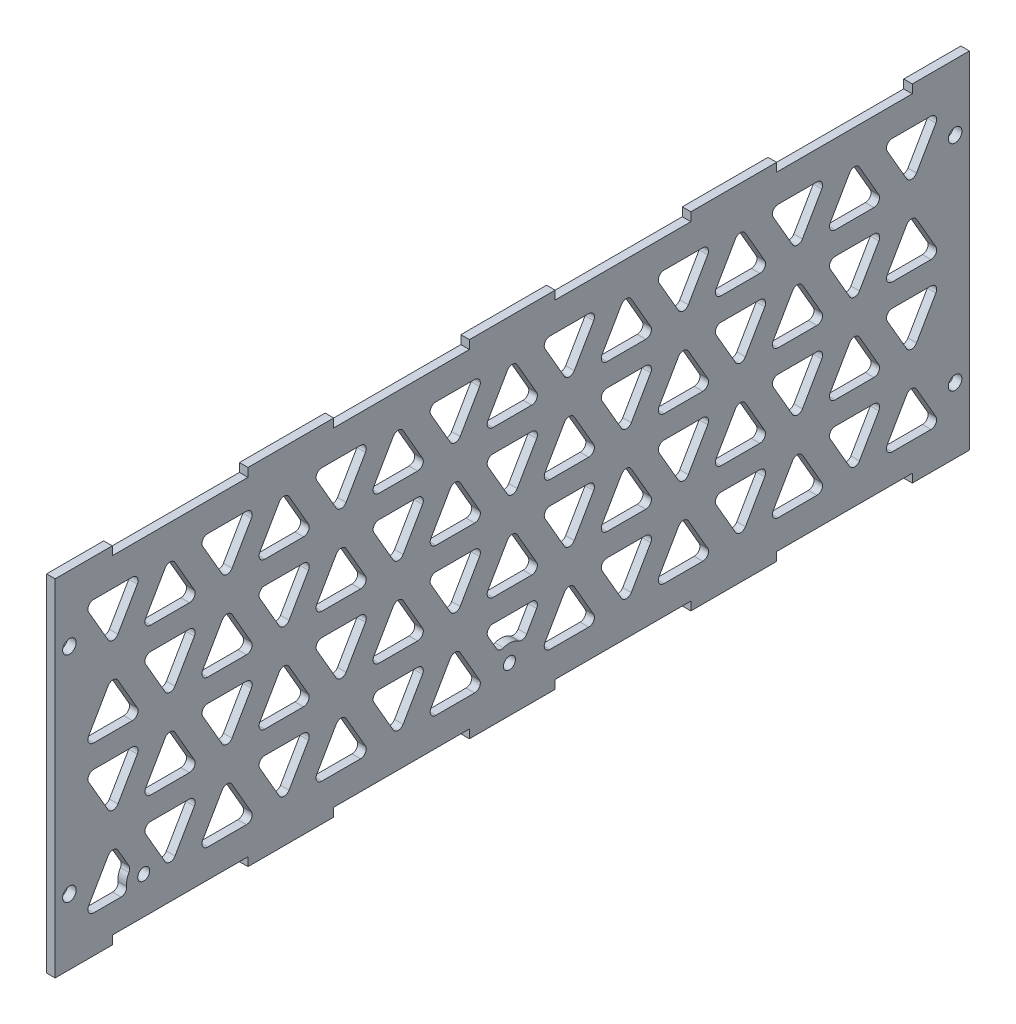
from build123d import *

# Parameters (mm, degrees)
SKETCH1_W           = 320
SKETCH1_H           = 115
BOSS_EXTRUDE1_DEPTH = 1.5
SKETCH2_W           = 20
SKETCH2_H           = 3
SKETCH2_W_2         = 30
BOSS_EXTRUDE2_DEPTH = 3
CUT_EXTRUDE3_REACH  = 173.083
SKETCH4_R           = 2.375
CUT_EXTRUDE4_DEPTH  = 3
SKETCH6_R           = 6
BOSS_EXTRUDE4_DEPTH = 3
SKETCH7_R           = 2.1
CUT_EXTRUDE6_DEPTH  = 172.082582398
FILLET2_R           = 2


with BuildPart() as part:
    # Sketch1 → Boss-Extrude1 (new, symmetric)
    with BuildSketch(Plane(origin=(0, 0, 0), x_dir=(0, 0, -1), z_dir=(1, 0, 0))):
        Rectangle(SKETCH1_W, SKETCH1_H)
    extrude(amount=BOSS_EXTRUDE1_DEPTH, both=True)

    # Sketch2 → Boss-Extrude2 (add)
    with BuildSketch(Plane(origin=(1.5, 0, 0), x_dir=(0, 0, -1), z_dir=(1, 0, 0))):
        with Locations((-150, 59)):
            Rectangle(SKETCH2_W, SKETCH2_H)
        with Locations((-77.5, 59)):
            Rectangle(SKETCH2_W_2, SKETCH2_H)
        with Locations((0, 59)):
            Rectangle(SKETCH2_W_2, SKETCH2_H)
        with Locations((77.5, 59)):
            Rectangle(SKETCH2_W_2, SKETCH2_H)
        with Locations((150, 59)):
            Rectangle(SKETCH2_W, SKETCH2_H)
    boss_extrude2 = extrude(amount=-BOSS_EXTRUDE2_DEPTH)

    # Mirror1: Boss-Extrude2 across plane
    add(boss_extrude2.mirror(Plane.ZX))

    # Sketch4 → Cut-Extrude3 (cut, up to next)
    with BuildSketch(Plane.ZY.offset(1.5), mode=Mode.PRIVATE) as cut_extrude3_sk1:
        with Locations((155, -37.5)):
            Circle(SKETCH4_R)
    cut_extrude3_tool1 = extrude(cut_extrude3_sk1.sketch, amount=-CUT_EXTRUDE3_REACH, mode=Mode.PRIVATE) & part.part
    # Sketch4 → Cut-Extrude3 (cut, up to next)
    with BuildSketch(Plane.ZY.offset(1.5), mode=Mode.PRIVATE) as cut_extrude3_sk2:
        with Locations((155, 37.5)):
            Circle(SKETCH4_R)
    cut_extrude3_tool2 = extrude(cut_extrude3_sk2.sketch, amount=-CUT_EXTRUDE3_REACH, mode=Mode.PRIVATE) & part.part
    # Sketch4 → Cut-Extrude3 (cut, up to next)
    with BuildSketch(Plane.ZY.offset(1.5), mode=Mode.PRIVATE) as cut_extrude3_sk3:
        with Locations((-155, -37.5)):
            Circle(SKETCH4_R)
    cut_extrude3_tool3 = extrude(cut_extrude3_sk3.sketch, amount=-CUT_EXTRUDE3_REACH, mode=Mode.PRIVATE) & part.part
    # Sketch4 → Cut-Extrude3 (cut, up to next)
    with BuildSketch(Plane.ZY.offset(1.5), mode=Mode.PRIVATE) as cut_extrude3_sk4:
        with Locations((-155, 37.5)):
            Circle(SKETCH4_R)
    cut_extrude3_tool4 = extrude(cut_extrude3_sk4.sketch, amount=-CUT_EXTRUDE3_REACH, mode=Mode.PRIVATE) & part.part
    add(cut_extrude3_tool1.solids().sort_by_distance((-1.5, -37.5, 155))[0], mode=Mode.SUBTRACT)
    add(cut_extrude3_tool2.solids().sort_by_distance((-1.5, 37.5, 155))[0], mode=Mode.SUBTRACT)
    add(cut_extrude3_tool3.solids().sort_by_distance((-1.5, -37.5, -155))[0], mode=Mode.SUBTRACT)
    add(cut_extrude3_tool4.solids().sort_by_distance((-1.5, 37.5, -155))[0], mode=Mode.SUBTRACT)

    # Sketch5 → Cut-Extrude4 (cut)
    with BuildSketch(Plane(origin=(1.5, 0, 0), x_dir=(0, 0, -1), z_dir=(1, 0, 0))):
        Polygon((-139.752032722, 29.75), (-150, 47.5), (-129.504065444, 47.5), align=None)
        Polygon((-130.035423897, 29.75), (-119.787456619, 47.5), (-109.539489341, 29.75), align=None)
        Polygon((-99.822880516, 29.75), (-110.070847794, 47.5), (-89.574913238, 47.5), align=None)
        Polygon((-90.106271691, 29.75), (-79.858304413, 47.5), (-69.610337134, 29.75), align=None)
        Polygon((-59.893728309, 29.75), (-70.141695587, 47.5), (-49.645761031, 47.5), align=None)
        Polygon((-50.177119484, 29.75), (-39.929152206, 47.5), (-29.681184928, 29.75), align=None)
        Polygon((-19.964576103, 29.75), (-30.212543381, 47.5), (-9.716608825, 47.5), align=None)
        Polygon((-10.247967278, 29.75), (0, 47.5), (10.247967278, 29.75), align=None)
        Polygon((19.964576103, 29.75), (9.716608825, 47.5), (30.212543381, 47.5), align=None)
        Polygon((29.681184928, 29.75), (39.929152206, 47.5), (50.177119484, 29.75), align=None)
        Polygon((59.893728309, 29.75), (49.645761031, 47.5), (70.141695587, 47.5), align=None)
        Polygon((69.610337134, 29.75), (79.858304413, 47.5), (90.106271691, 29.75), align=None)
        Polygon((99.822880516, 29.75), (89.574913238, 47.5), (110.070847794, 47.5), align=None)
        Polygon((109.539489341, 29.75), (119.787456619, 47.5), (130.035423897, 29.75), align=None)
        Polygon((139.752032722, 29.75), (129.504065444, 47.5), (150, 47.5), align=None)
        Polygon((139.752032722, 21.75), (129.504065444, 4), (150, 4), align=None)
        Polygon((139.752032722, -21.75), (129.504065444, -4), (150, -4), align=None)
        Polygon((139.752032722, -29.75), (129.504065444, -47.5), (150, -47.5), align=None)
        Polygon((109.539489341, -29.75), (119.787456619, -47.5), (130.035423897, -29.75), align=None)
        Polygon((109.539489341, -21.75), (119.787456619, -4), (130.035423897, -21.75), align=None)
        Polygon((109.539489341, 21.75), (119.787456619, 4), (130.035423897, 21.75), align=None)
        Polygon((99.822880516, 21.75), (89.574913238, 4), (110.070847794, 4), align=None)
        Polygon((99.822880516, -21.75), (89.574913238, -4), (110.070847794, -4), align=None)
        Polygon((99.822880516, -29.75), (89.574913238, -47.5), (110.070847794, -47.5), align=None)
        Polygon((69.610337134, -29.75), (79.858304413, -47.5), (90.106271691, -29.75), align=None)
        Polygon((69.610337134, -21.75), (79.858304413, -4), (90.106271691, -21.75), align=None)
        Polygon((69.610337134, 21.75), (79.858304413, 4), (90.106271691, 21.75), align=None)
        Polygon((59.893728309, 21.75), (49.645761031, 4), (70.141695587, 4), align=None)
        Polygon((59.893728309, -21.75), (49.645761031, -4), (70.141695587, -4), align=None)
        Polygon((59.893728309, -29.75), (49.645761031, -47.5), (70.141695587, -47.5), align=None)
        Polygon((29.681184928, -29.75), (39.929152206, -47.5), (50.177119484, -29.75), align=None)
        Polygon((29.681184928, -21.75), (39.929152206, -4), (50.177119484, -21.75), align=None)
        Polygon((29.681184928, 21.75), (39.929152206, 4), (50.177119484, 21.75), align=None)
        Polygon((19.964576103, 21.75), (9.716608825, 4), (30.212543381, 4), align=None)
        Polygon((19.964576103, -21.75), (9.716608825, -4), (30.212543381, -4), align=None)
        Polygon((19.964576103, -29.75), (9.716608825, -47.5), (30.212543381, -47.5), align=None)
        Polygon((-10.247967278, -29.75), (0, -47.5), (10.247967278, -29.75), align=None)
        Polygon((-10.247967278, -21.75), (0, -4), (10.247967278, -21.75), align=None)
        Polygon((-10.247967278, 21.75), (0, 4), (10.247967278, 21.75), align=None)
        Polygon((-19.964576103, 21.75), (-30.212543381, 4), (-9.716608825, 4), align=None)
        Polygon((-50.177119484, 21.75), (-39.929152206, 4), (-29.681184928, 21.75), align=None)
        Polygon((-50.177119484, -21.75), (-39.929152206, -4), (-29.681184928, -21.75), align=None)
        Polygon((-19.964576103, -21.75), (-30.212543381, -4), (-9.716608825, -4), align=None)
        Polygon((-19.964576103, -29.75), (-30.212543381, -47.5), (-9.716608825, -47.5), align=None)
        Polygon((-50.177119484, -29.75), (-39.929152206, -47.5), (-29.681184928, -29.75), align=None)
        Polygon((-59.893728309, 21.75), (-70.141695587, 4), (-49.645761031, 4), align=None)
        Polygon((-90.106271691, 21.75), (-79.858304413, 4), (-69.610337134, 21.75), align=None)
        Polygon((-99.822880516, 21.75), (-110.070847794, 4), (-89.574913238, 4), align=None)
        Polygon((-130.035423897, 21.75), (-119.787456619, 4), (-109.539489341, 21.75), align=None)
        Polygon((-139.752032722, 21.75), (-150, 4), (-129.504065444, 4), align=None)
        Polygon((-139.752032722, -21.75), (-150, -4), (-129.504065444, -4), align=None)
        Polygon((-130.035423897, -21.75), (-119.787456619, -4), (-109.539489341, -21.75), align=None)
        Polygon((-99.822880516, -21.75), (-110.070847794, -4), (-89.574913238, -4), align=None)
        Polygon((-90.106271691, -21.75), (-79.858304413, -4), (-69.610337134, -21.75), align=None)
        Polygon((-59.893728309, -21.75), (-70.141695587, -4), (-49.645761031, -4), align=None)
        Polygon((-59.893728309, -29.75), (-70.141695587, -47.5), (-49.645761031, -47.5), align=None)
        Polygon((-90.106271691, -29.75), (-79.858304413, -47.5), (-69.610337134, -29.75), align=None)
        Polygon((-99.822880516, -29.75), (-110.070847794, -47.5), (-89.574913238, -47.5), align=None)
        Polygon((-130.035423897, -29.75), (-119.787456619, -47.5), (-109.539489341, -29.75), align=None)
        Polygon((-139.752032722, -29.75), (-150, -47.5), (-129.504065444, -47.5), align=None)
    extrude(amount=-CUT_EXTRUDE4_DEPTH, mode=Mode.SUBTRACT)

    # Sketch6 → Boss-Extrude4 (add, through all)
    with BuildSketch(Plane.ZY.offset(1.5)):
        with Locations((1, -44.5)):
            Circle(SKETCH6_R)
        with Locations((129, -44.5)):
            Circle(SKETCH6_R)
    extrude(amount=-BOSS_EXTRUDE4_DEPTH)

    # Sketch7 → Cut-Extrude6 (cut, through all)
    with BuildSketch(Plane.ZY.offset(1.5)):
        with Locations((1, -44.5)):
            Circle(SKETCH7_R)
        with Locations((129, -44.5)):
            Circle(SKETCH7_R)
    extrude(amount=-CUT_EXTRUDE6_DEPTH, mode=Mode.SUBTRACT)

    # Fillet2
    fillet2_edges = [part.edges().sort_by_distance(p)[0] for p in [
        (0, -47.5, -89.574913238),
        (0, -29.75, -99.822880516),
        (0, -47.5, -110.070847794),
        (0, -47.5, -79.858304413),
        (0, -29.75, -69.610337134),
        (0, -29.75, -90.106271691),
        (0, -21.75, -99.822880516),
        (0, -4, -89.574913238),
        (0, -4, -110.070847794),
        (0, 4, -89.574913238),
        (0, 21.75, -99.822880516),
        (0, 4, -110.070847794),
        (0, 4, -119.787456619),
        (0, 21.75, -109.539489341),
        (0, 21.75, -130.035423897),
        (0, -21.75, -109.539489341),
        (0, -4, -119.787456619),
        (0, -21.75, -130.035423897),
        (0, -47.5, -129.504065444),
        (0, -29.75, -139.752032722),
        (0, -47.5, -150),
        (0, -47.5, -119.787456619),
        (0, -29.75, -109.539489341),
        (0, -29.75, -130.035423897),
        (0, 4, -39.929152206),
        (0, 21.75, -29.681184928),
        (0, 21.75, -50.177119484),
        (0, -21.75, -29.681184928),
        (0, -4, -39.929152206),
        (0, -21.75, -50.177119484),
        (0, -47.5, -49.645761031),
        (0, -29.75, -59.893728309),
        (0, -47.5, -70.141695587),
        (0, -47.5, -39.929152206),
        (0, -29.75, -29.681184928),
        (0, -29.75, -50.177119484),
        (0, -21.75, -69.610337134),
        (0, -4, -79.858304413),
        (0, -21.75, -90.106271691),
        (0, 4, -79.858304413),
        (0, 21.75, -69.610337134),
        (0, 21.75, -90.106271691),
        (0, 4, -49.645761031),
        (0, 21.75, -59.893728309),
        (0, 4, -70.141695587),
        (0, -21.75, -59.893728309),
        (0, -4, -49.645761031),
        (0, -4, -70.141695587),
        (0, 29.75, 19.964576103),
        (0, 47.5, 30.212543381),
        (0, 47.5, 9.716608825),
        (0, 29.75, 50.177119484),
        (0, 47.5, 39.929152206),
        (0, 29.75, 29.681184928),
        (0, 29.75, -19.964576103),
        (0, 47.5, -9.716608825),
        (0, 47.5, -30.212543381),
        (0, 29.75, 10.247967278),
        (0, 47.5, 0),
        (0, 29.75, -10.247967278),
        (0, 29.75, 99.822880516),
        (0, 47.5, 110.070847794),
        (0, 47.5, 89.574913238),
        (0, 29.75, 130.035423897),
        (0, 47.5, 119.787456619),
        (0, 29.75, 109.539489341),
        (0, 29.75, 59.893728309),
        (0, 47.5, 70.141695587),
        (0, 47.5, 49.645761031),
        (0, 29.75, 90.106271691),
        (0, 47.5, 79.858304413),
        (0, 29.75, 69.610337134),
        (0, -21.75, -139.752032722),
        (0, -4, -129.504065444),
        (0, -4, -150),
        (0, 4, -129.504065444),
        (0, 21.75, -139.752032722),
        (0, 4, -150),
        (0, 29.75, -109.539489341),
        (0, 47.5, -119.787456619),
        (0, 29.75, -130.035423897),
        (0, 29.75, -139.752032722),
        (0, 47.5, -129.504065444),
        (0, 47.5, -150),
        (0, 29.75, -59.893728309),
        (0, 47.5, -49.645761031),
        (0, 47.5, -70.141695587),
        (0, 29.75, -29.681184928),
        (0, 47.5, -39.929152206),
        (0, 29.75, -50.177119484),
        (0, 29.75, -99.822880516),
        (0, 47.5, -89.574913238),
        (0, 47.5, -110.070847794),
        (0, 29.75, -69.610337134),
        (0, 47.5, -79.858304413),
        (0, 29.75, -90.106271691),
        (0, -47.5, 70.141695587),
        (0, -29.75, 59.893728309),
        (0, -47.5, 49.645761031),
        (0, -47.5, 79.858304413),
        (0, -29.75, 90.106271691),
        (0, -29.75, 69.610337134),
        (0, -21.75, 90.106271691),
        (0, -4, 79.858304413),
        (0, -21.75, 69.610337134),
        (0, -21.75, 59.893728309),
        (0, -4, 70.141695587),
        (0, -4, 49.645761031),
        (0, 4, 150),
        (0, 21.75, 139.752032722),
        (0, 4, 129.504065444),
        (0, -21.75, 139.752032722),
        (0, -4, 150),
        (0, -4, 129.504065444),
        (0, -21.75, 99.822880516),
        (0, -4, 110.070847794),
        (0, -4, 89.574913238),
        (0, -21.75, 130.035423897),
        (0, -4, 119.787456619),
        (0, -21.75, 109.539489341),
        (0, -47.5, 150),
        (0, -29.75, 139.752032722),
        (0, -47.5, 110.070847794),
        (0, -29.75, 99.822880516),
        (0, -47.5, 89.574913238),
        (0, -47.5, 119.787456619),
        (0, -29.75, 130.035423897),
        (0, -29.75, 109.539489341),
        (0, -21.75, 10.247967278),
        (0, -4, 0),
        (0, -21.75, -10.247967278),
        (0, 4, 0),
        (0, 21.75, 10.247967278),
        (0, 21.75, -10.247967278),
        (0, 4, 39.929152206),
        (0, 21.75, 50.177119484),
        (0, 21.75, 29.681184928),
        (0, 4, 30.212543381),
        (0, 21.75, 19.964576103),
        (0, 4, 9.716608825),
        (0, -47.5, -9.716608825),
        (0, -29.75, -19.964576103),
        (0, -47.5, -30.212543381),
        (0, -29.75, 10.247967278),
        (0, -29.75, -10.247967278),
        (0, -21.75, -19.964576103),
        (0, -4, -9.716608825),
        (0, -4, -30.212543381),
        (0, 4, -9.716608825),
        (0, 21.75, -19.964576103),
        (0, 4, -30.212543381),
        (0, -21.75, 19.964576103),
        (0, -4, 30.212543381),
        (0, -4, 9.716608825),
        (0, -21.75, 50.177119484),
        (0, -4, 39.929152206),
        (0, -21.75, 29.681184928),
        (0, -47.5, 39.929152206),
        (0, -29.75, 50.177119484),
        (0, -29.75, 29.681184928),
        (0, -47.5, 30.212543381),
        (0, -29.75, 19.964576103),
        (0, -47.5, 9.716608825),
        (0, 4, 110.070847794),
        (0, 21.75, 99.822880516),
        (0, 4, 89.574913238),
        (0, 4, 119.787456619),
        (0, 21.75, 130.035423897),
        (0, 21.75, 109.539489341),
        (0, 4, 70.141695587),
        (0, 21.75, 59.893728309),
        (0, 4, 49.645761031),
        (0, 4, 79.858304413),
        (0, 21.75, 90.106271691),
        (0, 21.75, 69.610337134),
        (0, 29.75, 139.752032722),
        (0, 47.5, 150),
        (0, 47.5, 129.504065444),
        (0, -40.907927065, -3.805935084),
        (0, -39.649922642, 4.532244276),
        (0, -47.5, 134.196152423),
        (0, -40.550200193, 133.516534233),
    ]]
    fillet(fillet2_edges, radius=FILLET2_R)


solid = part.part
